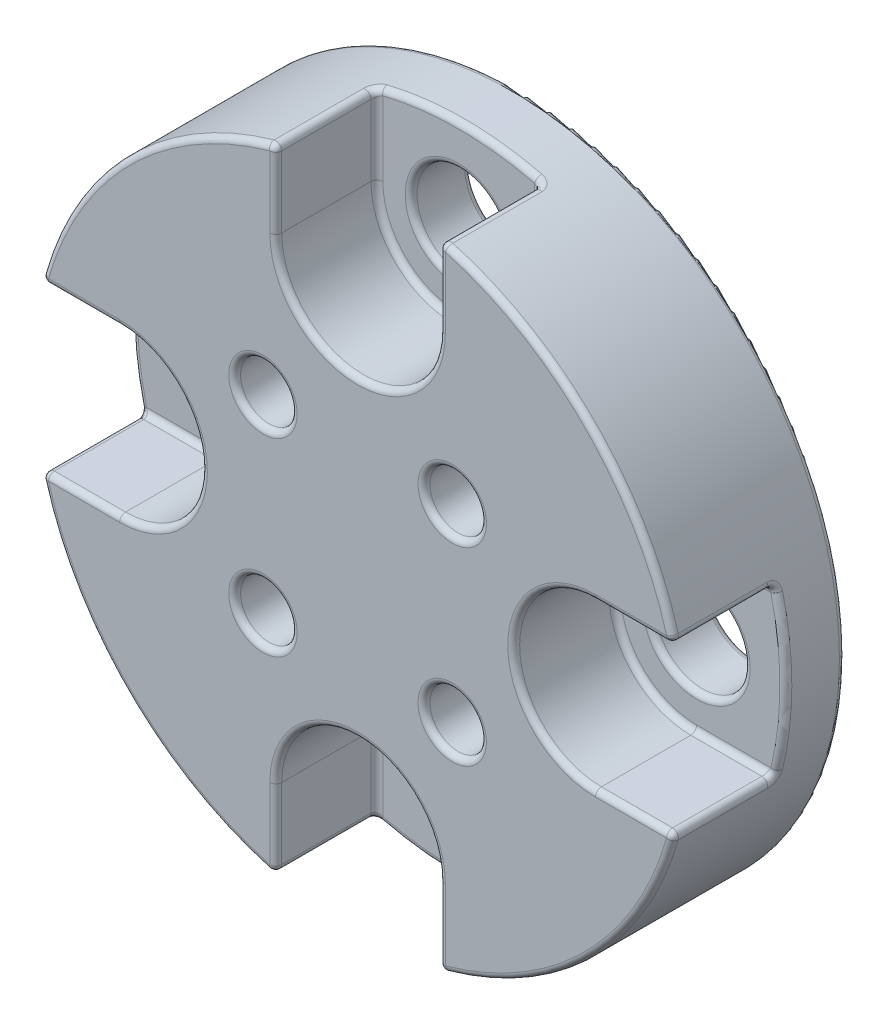
from build123d import *
from build123d.topology import SkipClean

# Parameters (mm, degrees)
SKETCH_1_R          = 15
SKETCH_1_R_2        = 11.5
EXTRUDE_1_DEPTH     = 1.8
EXTRUDE_START       = 2
SKETCH_1_3_R        = 15
EXTRUDE_2_DEPTH     = 2
SKETCH_2_R          = 1.6
CUT_EXTRUDE_1_DEPTH = 2
EXTRUDE_START_2     = 3.4
EXTRUDE_3_DEPTH     = 3.4
SKETCH_4_R          = 0.95
CUT_EXTRUDE_2_DEPTH = 23.401785643
SKETCH_5_R          = 30.103077633
SKETCH_5_R_2        = 11
CUT_EXTRUDE_3_DEPTH = 23.401785643
FILLET_1_R          = 0.2


with BuildPart() as part:
    # 스케치1 → 보스-돌출1 (new body)
    with BuildSketch(Plane.XY):
        Circle(SKETCH_1_R)
        Circle(SKETCH_1_R_2, mode=Mode.SUBTRACT)
    extrude(amount=-EXTRUDE_1_DEPTH)

    # 스케치1<3> → 보스-돌출2 (add)
    with BuildSketch(Plane.XY.offset(EXTRUDE_START)):
        Circle(SKETCH_1_3_R)
    extrude(amount=-EXTRUDE_2_DEPTH)

    # 스케치2 → 컷-돌출1 (cut)
    with BuildSketch(Plane.XY.offset(2)):
        with Locations((0, 8)):
            Circle(SKETCH_2_R)
        with Locations((8, 0)):
            Circle(SKETCH_2_R)
        with Locations((0, -8)):
            Circle(SKETCH_2_R)
        with Locations((-8, 0)):
            Circle(SKETCH_2_R)
    extrude(amount=-CUT_EXTRUDE_1_DEPTH, mode=Mode.SUBTRACT)

    # 스케치3 → 보스-돌출3 (add)
    with SkipClean():  # the faces are left unmerged after this step: merging them gives an invalid solid
        with BuildSketch(Plane.XY.offset(2).offset(EXTRUDE_START_2)):
            with BuildLine():
                Line((-8, 2.75), (-14.745762103, 2.75))
                ThreePointArc((-14.745762103, 2.75), (-10.606601718, 10.606601718), (-2.75, 14.745762103))
                Line((-2.75, 14.745762103), (-2.75, 8))
                ThreePointArc((-2.75, 8), (0, 5.25), (2.75, 8))
                Line((2.75, 8), (2.75, 14.745762103))
                ThreePointArc((2.75, 14.745762103), (10.606601718, 10.606601718), (14.745762103, 2.75))
                Line((14.745762103, 2.75), (8, 2.75))
                ThreePointArc((8, 2.75), (5.25, 0), (8, -2.75))
                Line((8, -2.75), (14.745762103, -2.75))
                ThreePointArc((14.745762103, -2.75), (10.606601718, -10.606601718), (2.75, -14.745762103))
                Line((2.75, -14.745762103), (2.75, -8))
                ThreePointArc((2.75, -8), (0, -5.25), (-2.75, -8))
                Line((-2.75, -8), (-2.75, -14.745762103))
                ThreePointArc((-2.75, -14.745762103), (-10.606601718, -10.606601718), (-14.745762103, -2.75))
                Line((-14.745762103, -2.75), (-8, -2.75))
                ThreePointArc((-8, -2.75), (-5.25, 0), (-8, 2.75))
            make_face()
        extrude(amount=-EXTRUDE_3_DEPTH)

    # 스케치4 → 컷-돌출2 (cut, through all)
    with SkipClean():  # the faces are left unmerged after this step: merging them gives an invalid solid
        with BuildSketch(Plane.XY.offset(5.4)):
            with Locations((3.181980515, 3.181980515)):
                Circle(SKETCH_4_R)
            with Locations((3.181980515, -3.181980515)):
                Circle(SKETCH_4_R)
            with Locations((-3.181980515, -3.181980515)):
                Circle(SKETCH_4_R)
            with Locations((-3.181980515, 3.181980515)):
                Circle(SKETCH_4_R)
        extrude(amount=-CUT_EXTRUDE_2_DEPTH, mode=Mode.SUBTRACT)

    # 스케치5 → 컷-돌출3 (cut, through all)
    with BuildSketch(Plane.XY.offset(5.4)):
        Circle(SKETCH_5_R)
        Circle(SKETCH_5_R_2, mode=Mode.SUBTRACT)
    extrude(amount=-CUT_EXTRUDE_3_DEPTH, mode=Mode.SUBTRACT)

    # 필렛1
    fillet_1_edges = [part.edges().sort_by_distance(p)[0] for p in [
        (2.75, -10.650704202, 3.7),
        (-2.75, -10.650704202, 3.7),
        (10.650704202, 2.75, 3.7),
        (10.650704202, -2.75, 3.7),
        (-2.75, 10.650704202, 3.7),
        (2.75, 10.650704202, 3.7),
        (-10.650704202, -2.75, 3.7),
        (-10.650704202, 2.75, 3.7),
        (-11, 0, 0),
        (-4.131980515, 3.181980515, 0),
        (-4.131980515, -3.181980515, 0),
        (2.231980515, -3.181980515, 0),
        (2.231980515, 3.181980515, 0),
        (-1.6, 8, 0),
        (6.4, 0, 0),
        (-1.6, -8, 0),
        (-9.6, 0, 0),
        (0, -5.25, 2),
        (2.75, -9.325352101, 2),
        (0, -11, 2),
        (-2.75, -9.325352101, 2),
        (-1.6, -8, 2),
        (5.25, 0, 2),
        (9.325352101, 2.75, 2),
        (10.912326659, 1.386047217, 2),
        (9.325352101, -2.75, 2),
        (6.4, 0, 2),
        (0, 5.25, 2),
        (-2.75, 9.325352101, 2),
        (0, 11, 2),
        (2.75, 9.325352101, 2),
        (-1.6, 8, 2),
        (-5.25, 0, 2),
        (-9.325352101, -2.75, 2),
        (-11, 0, 2),
        (-9.325352101, 2.75, 2),
        (-9.6, 0, 2),
        (5.25, 0, 5.4),
        (9.325352101, -2.75, 5.4),
        (7.778174593, -7.778174593, 5.4),
        (2.75, -9.325352101, 5.4),
        (0, -5.25, 5.4),
        (-2.75, -9.325352101, 5.4),
        (-7.778174593, -7.778174593, 5.4),
        (-9.325352101, -2.75, 5.4),
        (-5.25, 0, 5.4),
        (-9.325352101, 2.75, 5.4),
        (-7.778174593, 7.778174593, 5.4),
        (-2.75, 9.325352101, 5.4),
        (0, 5.25, 5.4),
        (2.75, 9.325352101, 5.4),
        (7.778174593, 7.778174593, 5.4),
        (9.325352101, 2.75, 5.4),
        (2.231980515, 3.181980515, 5.4),
        (2.231980515, -3.181980515, 5.4),
        (-4.131980515, -3.181980515, 5.4),
        (-4.131980515, 3.181980515, 5.4),
    ]]
    fillet(fillet_1_edges, radius=FILLET_1_R)


solid = part.part
